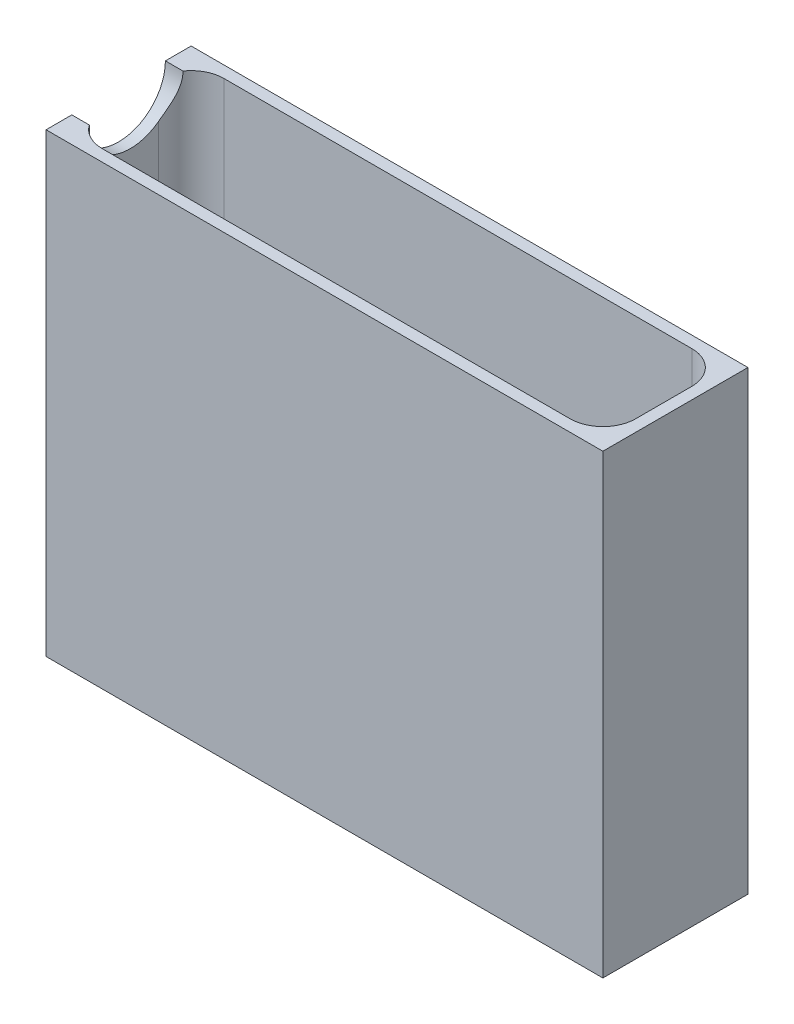
from build123d import *

# Parameters (mm, degrees)
SKETCH1_W               = 119
SKETCH1_H               = 31
SKETCH1_W_2             = 114
SKETCH1_H_2             = 26
EXTRUDE_THIN1_DEPTH     = 95
SKETCH2_W               = 119
SKETCH2_H               = 31
BOSS_EXTRUDE1_DEPTH     = 2.5
CUT_EXTRUDE1_DEPTH      = 155.913685645
CUT_EXTRUDE1_DEPTH_BACK = 2.5
FILLET2_R               = 7


with BuildPart() as part:
    # Sketch1 → Extrude-Thin1 (new body)
    with BuildSketch(Plane(origin=(0, 0, 0), x_dir=(1, 0, 0), z_dir=(0, 1, 0))):
        with Locations((-57, -13)):
            Rectangle(SKETCH1_W, SKETCH1_H)
        with Locations((-57, -13)):
            Rectangle(SKETCH1_W_2, SKETCH1_H_2, mode=Mode.SUBTRACT)
    extrude(amount=EXTRUDE_THIN1_DEPTH)

    # Sketch2 → Boss-Extrude1 (add)
    with BuildSketch(Plane.XZ):
        with Locations((-57, 13)):
            Rectangle(SKETCH2_W, SKETCH2_H)
    extrude(amount=BOSS_EXTRUDE1_DEPTH)

    # Sketch3 → Cut-Extrude1 (cut, two sides: drawn at the far end of the back side and taken through both)
    with BuildSketch(Plane.ZY.offset(116.5).offset(-CUT_EXTRUDE1_DEPTH_BACK)):
        with BuildLine():
            Line((3, 306.558924387), (3, 95))
            ThreePointArc((3, 95), (13, 85), (23, 95))
            Line((23, 95), (23, 306.558924387))
            Line((23, 306.558924387), (23, 729.676773161))
            Line((23, 729.676773161), (3, 729.676773161))
            Line((3, 729.676773161), (3, 306.558924387))
        make_face()
    extrude(amount=CUT_EXTRUDE1_DEPTH + CUT_EXTRUDE1_DEPTH_BACK, mode=Mode.SUBTRACT)

    # Fillet2
    # the kernel refuses this fillet: 7 mm, written as the material it adds along each edge
    with BuildSketch(Plane(origin=(0, 0, 26), x_dir=(-1, 0, 0), z_dir=(0, 1, 0)), Plane(origin=(0, 0, 0), x_dir=(0, 0, 1), z_dir=(0, 1, 0))) as fillet2_piece_1:
        with BuildLine():
            CenterArc((FILLET2_R, -FILLET2_R), FILLET2_R, 90, 90)
            Line((0, -FILLET2_R), (0, 0))
            Line((0, 0), (FILLET2_R, 0))
        make_face()
    extrude(amount=95)
    with BuildSketch(Plane(origin=(-114, 0, 26), x_dir=(0, 0, -1), z_dir=(0, 1, 0))) as fillet2_piece_2_section:
        with BuildLine():
            CenterArc((FILLET2_R, -FILLET2_R), FILLET2_R, 90, 90)
            Line((0, -FILLET2_R), (0, 0))
            Line((0, 0), (FILLET2_R, 0))
        make_face()
    fillet2_piece_2 = extrude(amount=95, mode=Mode.PRIVATE)
    fillet2_piece_2 = fillet2_piece_2 - Plane(origin=(-112.403974481, 95, 13), x_dir=(0, 0, -1), z_dir=(1, 0, 0)) * Cylinder(10, 218, mode=Mode.PRIVATE)
    add(fillet2_piece_2)
    with BuildSketch(Plane(origin=(-114, 0, 0), x_dir=(0, 0, 1), z_dir=(0, 1, 0))) as fillet2_piece_3_section:
        with BuildLine():
            CenterArc((FILLET2_R, FILLET2_R), FILLET2_R, 180, 90)
            Line((0, FILLET2_R), (0, 0))
            Line((0, 0), (FILLET2_R, 0))
        make_face()
    fillet2_piece_3 = extrude(amount=95, mode=Mode.PRIVATE)
    fillet2_piece_3 = fillet2_piece_3 - Plane(origin=(-112.403974465, 95, 13), x_dir=(0, 0, -1), z_dir=(1, 0, 0)) * Cylinder(10, 218, mode=Mode.PRIVATE)
    add(fillet2_piece_3)


solid = part.part
